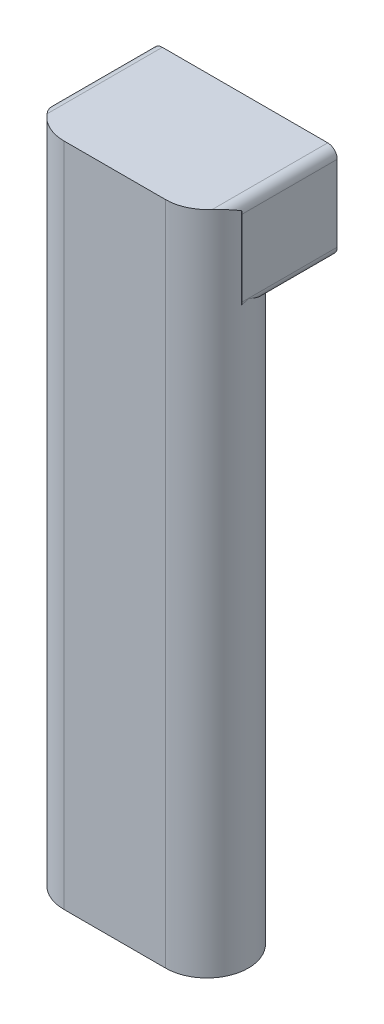
from build123d import *

# Parameters (mm, degrees)
SKETCH_1_R      = 0.26
EXTRUDE_1_DEPTH = 6
EXTRUDE_2_DEPTH = 1
SKETCH_4_W      = 1.94
SKETCH_4_H      = 1
SKETCH_4_R      = 0.4
EXTRUDE_3_DEPTH = 0.5
EXTRUDE_START   = -0.5
SKETCH_4_2_W    = 1.94
SKETCH_4_2_H    = 1
SKETCH_4_2_R    = 0.4
EXTRUDE_4_DEPTH = 0.5
FILLET_1_R      = 0.1


with BuildPart() as part:
    # Эскиз1 → Бобышка-Вытянуть1 (new body)
    with BuildSketch(Plane(origin=(0, 0, 0), x_dir=(1, 0, 0), z_dir=(0, 1, 0))):
        with BuildLine():
            Line((-0.535, 0.435), (0.535, 0.434896152))
            ThreePointArc((0.535, 0.434896152), (0.969896152, 0), (0.535, -0.434896152))
            Line((0.535, -0.434896152), (-0.535, -0.435))
            ThreePointArc((-0.535, -0.435), (-0.97, 0), (-0.535, 0.435))
        make_face()
        with Locations((-0.535, 0)):
            Circle(SKETCH_1_R, mode=Mode.SUBTRACT)
        with Locations((0.535, 0)):
            Circle(SKETCH_1_R, mode=Mode.SUBTRACT)
    extrude(amount=EXTRUDE_1_DEPTH)

    # Эскиз3 → Бобышка-Вытянуть2 (add)
    with BuildSketch(Plane(origin=(0, 6, 0), x_dir=(1, 0, 0), z_dir=(0, 1, 0))):
        with BuildLine():
            Line((-0.535, -0.435), (0.535, -0.434896152))
            ThreePointArc((0.535, -0.434896152), (0.969896152, 0), (0.535, 0.434896152))
            Line((0.535, 0.434896152), (-0.535, 0.435))
            ThreePointArc((-0.535, 0.435), (-0.97, 0), (-0.535, -0.435))
        make_face()
    extrude(amount=EXTRUDE_2_DEPTH)

    # Эскиз4 → Бобышка-Вытянуть3 (add)
    with BuildSketch(Plane(origin=(4.2214e-05, 0, -0.434948072), x_dir=(-0.9999999952901986, 0, -9.705463944489652e-05), z_dir=(9.705463944489651e-05, 0, -0.9999999952901985))):
        with Locations((4.2214e-05, 6.5)):
            Rectangle(SKETCH_4_W, SKETCH_4_H)
        with Locations((-0.499957786, 6.5)):
            Circle(SKETCH_4_R, mode=Mode.SUBTRACT)
        with Locations((0.500042214, 6.5)):
            Circle(SKETCH_4_R, mode=Mode.SUBTRACT)
    extrude(amount=EXTRUDE_3_DEPTH)

    # Эскиз4<2> → Бобышка-Вытянуть4 (add)
    with BuildSketch(Plane(origin=(4.2214e-05, 0, -0.434948072), x_dir=(-0.9999999952901986, 0, -9.705463944489652e-05), z_dir=(9.705463944489651e-05, 0, -0.9999999952901985)).offset(EXTRUDE_START)):
        with Locations((4.2214e-05, 6.5)):
            Rectangle(SKETCH_4_2_W, SKETCH_4_2_H)
        with Locations((-0.499957786, 6.5)):
            Circle(SKETCH_4_2_R, mode=Mode.SUBTRACT)
        with Locations((0.500042214, 6.5)):
            Circle(SKETCH_4_2_R, mode=Mode.SUBTRACT)
    extrude(amount=EXTRUDE_4_DEPTH)

    # Скругление1
    fillet_1_edges = [part.edges().sort_by_distance(p)[0] for p in [
        (-0.969999995, 6, -0.435042219),
        (-0.969999995, 7, -0.435042219),
        (0.969999995, 6, -0.434853933),
        (0.969999995, 7, -0.434853933),
    ]]
    fillet(fillet_1_edges, radius=FILLET_1_R)


solid = part.part
